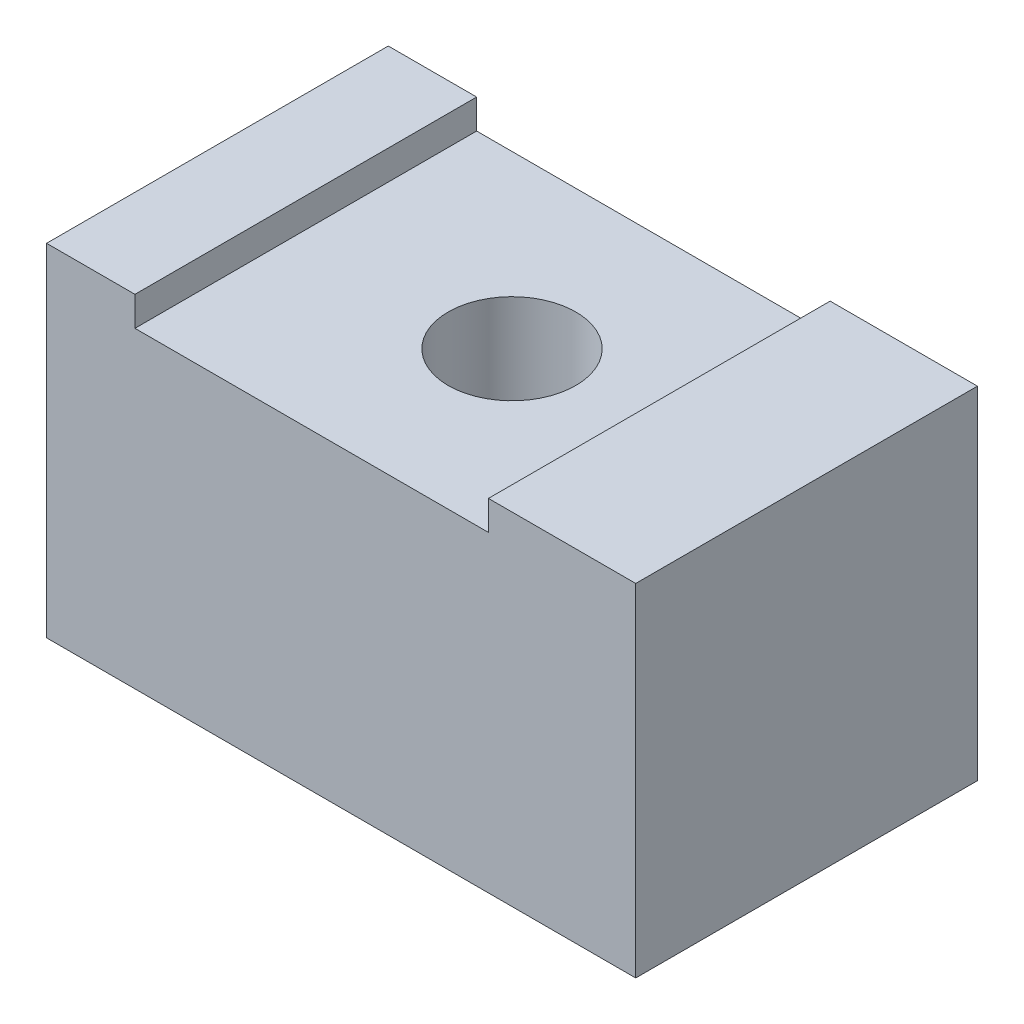
from build123d import *

# Parameters (mm, degrees)
SKETCH1_W           = 14.732
SKETCH1_H           = 14.732
BOSS_EXTRUDE1_DEPTH = 25.4
SKETCH2_R           = 2.75
CUT_EXTRUDE1_DEPTH  = 31.272921564
SKETCH3_W           = 10
SKETCH3_H           = 6.858
SKETCH3_R           = 1.5875
CUT_EXTRUDE2_DEPTH  = 1.778
FILLET1_R           = 0.79375
SKETCH7_W           = 15.24
SKETCH7_H           = 14.732
CUT_EXTRUDE3_DEPTH  = 1.27


with BuildPart() as part:
    # Sketch1 → Boss-Extrude1 (new body)
    with BuildSketch(Plane(origin=(0, 0, 0), x_dir=(0, 0, -1), z_dir=(1, 0, 0))):
        Rectangle(SKETCH1_W, SKETCH1_H)
    extrude(amount=BOSS_EXTRUDE1_DEPTH)

    # Sketch2 → Cut-Extrude1 (cut, through all)
    with BuildSketch(Plane(origin=(0, 7.366, 0), x_dir=(1, 0, 0), z_dir=(0, 1, 0))):
        with Locations((12.7, 0)):
            Circle(SKETCH2_R)
    extrude(amount=-CUT_EXTRUDE1_DEPTH, mode=Mode.SUBTRACT)

    # Sketch3 → Cut-Extrude2 (cut)
    with BuildSketch(Plane(origin=(0, 0, -7.366), x_dir=(-1, 0, 0), z_dir=(0, 0, -1))):
        with Locations((-5, -0.063)):
            Rectangle(SKETCH3_W, SKETCH3_H)
        with Locations((-4.92, -0.063)):
            Circle(SKETCH3_R, mode=Mode.SUBTRACT)
    extrude(amount=-CUT_EXTRUDE2_DEPTH, mode=Mode.SUBTRACT)

    # Fillet1
    fillet1_edges = [part.edges().sort_by_distance(p)[0] for p in [
        (10, 3.366, -6.477),
        (10, -3.492, -6.477),
    ]]
    fillet(fillet1_edges, radius=FILLET1_R)

    # Sketch7 → Cut-Extrude3 (cut)
    with BuildSketch(Plane(origin=(0, 7.366, 0), x_dir=(1, 0, 0), z_dir=(0, 1, 0))):
        with Locations((11.43, 0)):
            Rectangle(SKETCH7_W, SKETCH7_H)
    extrude(amount=-CUT_EXTRUDE3_DEPTH, mode=Mode.SUBTRACT)


solid = part.part
